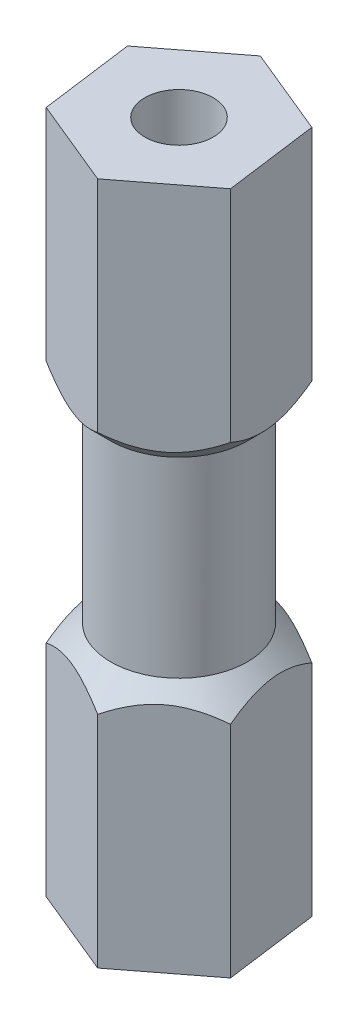
from build123d import *

# Parameters (mm, degrees)
SKETCH_1_R          = 2.5
EXTRUDE_1_DEPTH     = 25
EXTRUDE_2_DEPTH     = 8
EXTRUDE_3_DEPTH     = 8
CHAMFER_1_SIZE      = 1
SKETCH_4_R          = 1.25
CUT_EXTRUDE_1_DEPTH = 8
CUT_EXTRUDE_START   = 8
SKETCH_5_R          = 1.25
CUT_EXTRUDE_2_DEPTH = 8


with BuildPart() as part:
    # 草图1 → 凸台-拉伸1 (new body)
    with BuildSketch(Plane(origin=(0, 0, 0), x_dir=(1, 0, 0), z_dir=(0, 1, 0))):
        with Locations(Location((0, 0, 0), (0, 0, 270))):
            Circle(SKETCH_1_R)
    extrude(amount=EXTRUDE_1_DEPTH)

    # 草图2 → 凸台-拉伸2 (add)
    with BuildSketch(Plane(origin=(0, 25, 0), x_dir=(1, 0, 0), z_dir=(0, 1, 0))):
        Polygon((3.202903935, -1.319623577), (2.744279509, 2.113984385), (-0.458624426, 3.433607962), (-3.202903935, 1.319623577), (-2.744279509, -2.113984385), (0.458624426, -3.433607962), align=None)
    extrude(amount=-EXTRUDE_2_DEPTH)

    # 草图3 → 凸台-拉伸3 (add)
    with BuildSketch(Plane.XZ):
        Polygon((3.202903935, 1.319623577), (0.458624426, 3.433607962), (-2.744279509, 2.113984385), (-3.202903935, -1.319623577), (-0.458624426, -3.433607962), (2.744279509, -2.113984385), align=None)
    extrude(amount=-EXTRUDE_3_DEPTH)

    # 倒角1
    # the kernel refuses this chamfer: 1 mm, written as the material it adds along each edge
    with BuildSketch(Plane(origin=(0, 17, 0), x_dir=(0, 0, 1), z_dir=(1, 0, 0))) as chamfer_1_piece_1_section:
        Polygon((2.5, CHAMFER_1_SIZE), (2.5 + CHAMFER_1_SIZE, 0), (2.5, 0), align=None)
    chamfer_1_piece_1 = revolve(axis=Axis((0, 17, 0), (0, -1, 0)), mode=Mode.PRIVATE)
    chamfer_1_piece_1 = split(chamfer_1_piece_1, bisect_by=Plane(origin=(2.585980682, 16.482096178, -3.299128656), z_dir=(-0.9911972405355005, 0, 0.13239346794615373)), keep=Keep.TOP, mode=Mode.PRIVATE)
    chamfer_1_piece_1 = split(chamfer_1_piece_1, bisect_by=Plane(origin=(3.258731824, 16.482096178, 1.276618014), z_dir=(-0.61025472680424, 0, -0.7922052564917015)), keep=Keep.TOP, mode=Mode.PRIVATE)
    chamfer_1_piece_1 = split(chamfer_1_piece_1, bisect_by=Plane(origin=(0.102470937, 16.482096178, -3.202431915), z_dir=(-0.3809425137312606, 0, 0.924598724437855)), keep=Keep.TOP, mode=Mode.PRIVATE)
    chamfer_1_piece_1 = split(chamfer_1_piece_1, bisect_by=Plane(origin=(-2.183184145, 16.482096178, 2.345160432), z_dir=(0.38094251373126053, 0, -0.924598724437855)), keep=Keep.TOP, mode=Mode.PRIVATE)
    chamfer_1_piece_1 = split(chamfer_1_piece_1, bisect_by=Plane(origin=(-0.402796537, 16.482096178, -3.476613525), z_dir=(0.6102547268042401, 0, 0.7922052564917015)), keep=Keep.TOP, mode=Mode.PRIVATE)
    chamfer_1_piece_1 = split(chamfer_1_piece_1, bisect_by=Plane(origin=(-3.361202761, 16.482096178, -2.504767848), z_dir=(0.9911972405355005, 0, -0.1323934679461537)), keep=Keep.TOP, mode=Mode.PRIVATE)
    add(chamfer_1_piece_1)
    with BuildSketch(Plane(origin=(0, 8, 0), x_dir=(0, 0, 1), z_dir=(1, 0, 0))) as chamfer_1_piece_2_section:
        Polygon((2.5 + CHAMFER_1_SIZE, 0), (2.5, -CHAMFER_1_SIZE), (2.5, 0), align=None)
    chamfer_1_piece_2 = revolve(axis=Axis((0, 8, 0), (0, -1, 0)), mode=Mode.PRIVATE)
    chamfer_1_piece_2 = split(chamfer_1_piece_2, bisect_by=Plane(origin=(3.258731824, 8.517903822, 1.276618014), z_dir=(-0.61025472680424, 0, -0.7922052564917015)), keep=Keep.TOP, mode=Mode.PRIVATE)
    chamfer_1_piece_2 = split(chamfer_1_piece_2, bisect_by=Plane(origin=(2.585980682, 8.517903822, -3.299128656), z_dir=(-0.9911972405355005, 0, 0.13239346794615373)), keep=Keep.TOP, mode=Mode.PRIVATE)
    chamfer_1_piece_2 = split(chamfer_1_piece_2, bisect_by=Plane(origin=(-2.183184145, 8.517903822, 2.345160432), z_dir=(0.38094251373126053, 0, -0.924598724437855)), keep=Keep.TOP, mode=Mode.PRIVATE)
    chamfer_1_piece_2 = split(chamfer_1_piece_2, bisect_by=Plane(origin=(0.102470937, 8.517903822, -3.202431915), z_dir=(-0.3809425137312606, 0, 0.924598724437855)), keep=Keep.TOP, mode=Mode.PRIVATE)
    chamfer_1_piece_2 = split(chamfer_1_piece_2, bisect_by=Plane(origin=(-3.361202761, 8.517903822, -2.504767848), z_dir=(0.9911972405355005, 0, -0.1323934679461537)), keep=Keep.TOP, mode=Mode.PRIVATE)
    chamfer_1_piece_2 = split(chamfer_1_piece_2, bisect_by=Plane(origin=(-0.402796537, 8.517903822, -3.476613525), z_dir=(0.6102547268042401, 0, 0.7922052564917015)), keep=Keep.TOP, mode=Mode.PRIVATE)
    add(chamfer_1_piece_2)

    # 草图4 → 切除-拉伸1 (cut)
    with BuildSketch(Plane(origin=(0, 0, 0), x_dir=(-1, 0, 0), z_dir=(0, 1, 0))):
        with Locations(Location((0, 0, 0), (0, 0, 90))):
            Circle(SKETCH_4_R)
    extrude(amount=CUT_EXTRUDE_1_DEPTH, mode=Mode.SUBTRACT)

    # 草图5 → 切除-拉伸2 (cut)
    with BuildSketch(Plane(origin=(0, 25, 0), x_dir=(-1, 0, 0), z_dir=(0, -1, 0)).offset(CUT_EXTRUDE_START)):
        with Locations(Location((0, 0, 0), (0, 0, 270))):
            Circle(SKETCH_5_R)
    extrude(amount=-CUT_EXTRUDE_2_DEPTH, mode=Mode.SUBTRACT)


solid = part.part
